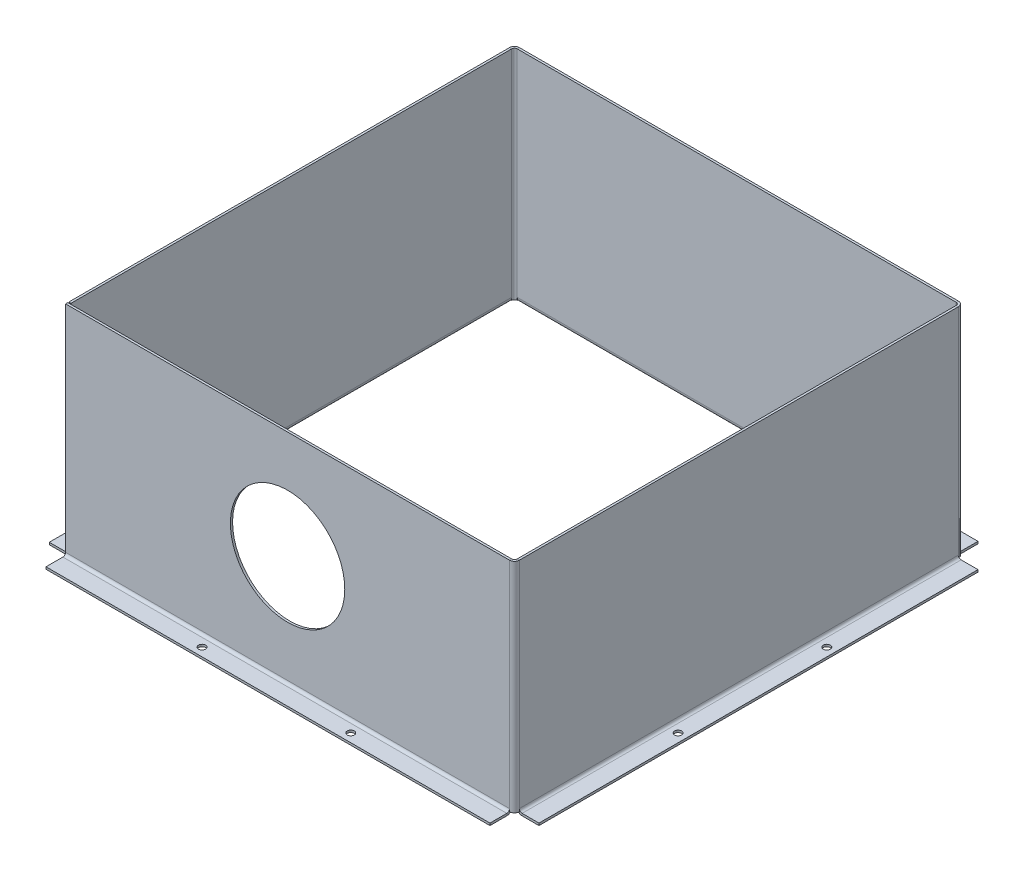
from build123d import *

# Parameters (mm, degrees)
SKETCH1_W                    = 410
SKETCH1_H                    = 200
BASE_FLANGE1_DEPTH           = 2
EDGE_FLANGE2_STRIP_W         = 13
EDGE_FLANGE2_STRIP_H         = 2
EDGE_FLANGE2_STRIP_CUT_DEPTH = 200
EDGE_FLANGE2_DEPTH           = 200
EDGE_FLANGE4_STRIP_W         = 13
EDGE_FLANGE4_STRIP_H         = 2
EDGE_FLANGE4_STRIP_CUT_DEPTH = 200
EDGE_FLANGE4_DEPTH           = 200
EDGE_FLANGE5_STRIP_W         = 13
EDGE_FLANGE5_STRIP_H         = 2
EDGE_FLANGE5_STRIP_CUT_DEPTH = 200
EDGE_FLANGE5_DEPTH           = 200
EDGE_FLANGE6_STRIP_W         = 13
EDGE_FLANGE6_STRIP_H         = 2
EDGE_FLANGE6_STRIP_CUT_DEPTH = 403
EDGE_FLANGE6_DEPTH           = 403
EDGE_FLANGE7_STRIP_W         = 13
EDGE_FLANGE7_STRIP_H         = 2
EDGE_FLANGE7_STRIP_CUT_DEPTH = 403
EDGE_FLANGE7_DEPTH           = 403
EDGE_FLANGE8_STRIP_W         = 13
EDGE_FLANGE8_STRIP_H         = 2
EDGE_FLANGE8_STRIP_CUT_DEPTH = 407.5
EDGE_FLANGE8_DEPTH           = 407.5
EDGE_FLANGE9_STRIP_W         = 13
EDGE_FLANGE9_STRIP_H         = 2
EDGE_FLANGE9_STRIP_CUT_DEPTH = 404.5
EDGE_FLANGE9_DEPTH           = 404.5
SKETCH29_R                   = 52.5
CUT_EXTRUDE1_DEPTH           = 10
SKETCH30_R                   = 3.25
CUT_EXTRUDE2_DEPTH           = 10


# Sheet-metal steps are written as plain solids
with BuildPart() as part:
    # Sketch1 → Base-Flange1 (new body)
    with BuildSketch(Plane.XY):
        with Locations((-14.494949495, 3.017676768)):
            Rectangle(SKETCH1_W, SKETCH1_H)
    extrude(amount=-BASE_FLANGE1_DEPTH)

    # Edge-Flange2 strip (across the edge) → Edge-Flange2 strip cut (cut)
    with BuildSketch(Plane(origin=(190.505050505, 103.017676768, -2), x_dir=(-1, 0, 0), z_dir=(0, -1, 0))):
        with Locations((-4, -1)):
            Rectangle(EDGE_FLANGE2_STRIP_W, EDGE_FLANGE2_STRIP_H)
    extrude(amount=EDGE_FLANGE2_STRIP_CUT_DEPTH, mode=Mode.SUBTRACT)

    # Edge-Flange2 section (across the edge) → Edge-Flange2 (add)
    with BuildSketch(Plane(origin=(190.505050505, 103.017676768, -2), x_dir=(-1, 0, 0), z_dir=(0, -1, 0))):
        with BuildLine():
            Line((-2, 2.5), (-2, 408))
            Line((-2, 408), (0, 408))
            Line((0, 408), (0, 2.5))
            ThreePointArc((0, 2.5), (0.732233047, 0.732233047), (2.5, 0))
            Line((2.5, 0), (2.5, -2))
            ThreePointArc((2.5, -2), (-0.681980515, -0.681980515), (-2, 2.5))
        make_face()
    extrude(amount=EDGE_FLANGE2_DEPTH)

    # Edge-Flange4 strip (across the edge) → Edge-Flange4 strip cut (cut)
    with BuildSketch(Plane(origin=(190.505050505, 103.017676768, -410), x_dir=(0, 0, 1), z_dir=(0, -1, 0))):
        with Locations((-4, -1)):
            Rectangle(EDGE_FLANGE4_STRIP_W, EDGE_FLANGE4_STRIP_H)
    extrude(amount=EDGE_FLANGE4_STRIP_CUT_DEPTH, mode=Mode.SUBTRACT)

    # Edge-Flange4 section (across the edge) → Edge-Flange4 (add)
    with BuildSketch(Plane(origin=(190.505050505, 103.017676768, -410), x_dir=(0, 0, 1), z_dir=(0, -1, 0))):
        with BuildLine():
            Line((-2, 2.5), (-2, 408))
            Line((-2, 408), (0, 408))
            Line((0, 408), (0, 2.5))
            ThreePointArc((0, 2.5), (0.732233047, 0.732233047), (2.5, 0))
            Line((2.5, 0), (2.5, -2))
            ThreePointArc((2.5, -2), (-0.681980515, -0.681980515), (-2, 2.5))
        make_face()
    extrude(amount=EDGE_FLANGE4_DEPTH)

    # Edge-Flange5 strip (across the edge) → Edge-Flange5 strip cut (cut)
    with BuildSketch(Plane(origin=(-217.494949495, 103.017676768, -410), x_dir=(1, 0, 0), z_dir=(0, -1, 0))):
        with Locations((-4, -1)):
            Rectangle(EDGE_FLANGE5_STRIP_W, EDGE_FLANGE5_STRIP_H)
    extrude(amount=EDGE_FLANGE5_STRIP_CUT_DEPTH, mode=Mode.SUBTRACT)

    # Edge-Flange5 section (across the edge) → Edge-Flange5 (add)
    with BuildSketch(Plane(origin=(-217.494949495, 103.017676768, -410), x_dir=(1, 0, 0), z_dir=(0, -1, 0))):
        with BuildLine():
            Line((-2, 2.5), (-2, 407))
            Line((-2, 407), (0, 407))
            Line((0, 407), (0, 2.5))
            ThreePointArc((0, 2.5), (0.732233047, 0.732233047), (2.5, 0))
            Line((2.5, 0), (2.5, -2))
            ThreePointArc((2.5, -2), (-0.681980515, -0.681980515), (-2, 2.5))
        make_face()
    extrude(amount=EDGE_FLANGE5_DEPTH)

    # Edge-Flange6 strip (across the edge) → Edge-Flange6 strip cut (cut)
    with BuildSketch(Plane(origin=(188.005050505, -96.982323232, -412), x_dir=(0, 1, 0), z_dir=(-1, 0, 0))):
        with Locations((-4, -1)):
            Rectangle(EDGE_FLANGE6_STRIP_W, EDGE_FLANGE6_STRIP_H)
    extrude(amount=EDGE_FLANGE6_STRIP_CUT_DEPTH, mode=Mode.SUBTRACT)

    # Edge-Flange6 section (across the edge) → Edge-Flange6 (add)
    with BuildSketch(Plane(origin=(188.005050505, -96.982323232, -412), x_dir=(0, 1, 0), z_dir=(-1, 0, 0))):
        with BuildLine():
            Line((-2, 2.5), (-2, 18))
            Line((-2, 18), (0, 18))
            Line((0, 18), (0, 2.5))
            ThreePointArc((0, 2.5), (0.732233047, 0.732233047), (2.5, 0))
            Line((2.5, 0), (2.5, -2))
            ThreePointArc((2.5, -2), (-0.681980515, -0.681980515), (-2, 2.5))
        make_face()
    extrude(amount=EDGE_FLANGE6_DEPTH)

    # Edge-Flange7 strip (across the edge) → Edge-Flange7 strip cut (cut)
    with BuildSketch(Plane(origin=(192.505050505, -96.982323232, -4.5), x_dir=(0, 1, 0), z_dir=(0, 0, -1))):
        with Locations((-4, -1)):
            Rectangle(EDGE_FLANGE7_STRIP_W, EDGE_FLANGE7_STRIP_H)
    extrude(amount=EDGE_FLANGE7_STRIP_CUT_DEPTH, mode=Mode.SUBTRACT)

    # Edge-Flange7 section (across the edge) → Edge-Flange7 (add)
    with BuildSketch(Plane(origin=(192.505050505, -96.982323232, -4.5), x_dir=(0, 1, 0), z_dir=(0, 0, -1))):
        with BuildLine():
            Line((-2, 2.5), (-2, 18))
            Line((-2, 18), (0, 18))
            Line((0, 18), (0, 2.5))
            ThreePointArc((0, 2.5), (0.732233047, 0.732233047), (2.5, 0))
            Line((2.5, 0), (2.5, -2))
            ThreePointArc((2.5, -2), (-0.681980515, -0.681980515), (-2, 2.5))
        make_face()
    extrude(amount=EDGE_FLANGE7_DEPTH)

    # Edge-Flange8 strip (across the edge) → Edge-Flange8 strip cut (cut)
    with BuildSketch(Plane(origin=(-219.494949495, -96.982323232, 0), x_dir=(0, 1, 0), z_dir=(1, 0, 0))):
        with Locations((-4, -1)):
            Rectangle(EDGE_FLANGE8_STRIP_W, EDGE_FLANGE8_STRIP_H)
    extrude(amount=EDGE_FLANGE8_STRIP_CUT_DEPTH, mode=Mode.SUBTRACT)

    # Edge-Flange8 section (across the edge) → Edge-Flange8 (add)
    with BuildSketch(Plane(origin=(-219.494949495, -96.982323232, 0), x_dir=(0, 1, 0), z_dir=(1, 0, 0))):
        with BuildLine():
            Line((-2, 2.5), (-2, 18))
            Line((-2, 18), (0, 18))
            Line((0, 18), (0, 2.5))
            ThreePointArc((0, 2.5), (0.732233047, 0.732233047), (2.5, 0))
            Line((2.5, 0), (2.5, -2))
            ThreePointArc((2.5, -2), (-0.681980515, -0.681980515), (-2, 2.5))
        make_face()
    extrude(amount=EDGE_FLANGE8_DEPTH)

    # Edge-Flange9 strip (across the edge) → Edge-Flange9 strip cut (cut)
    with BuildSketch(Plane(origin=(-219.494949495, -96.982323232, -407.5), x_dir=(0, 1, 0), z_dir=(0, 0, 1))):
        with Locations((-4, -1)):
            Rectangle(EDGE_FLANGE9_STRIP_W, EDGE_FLANGE9_STRIP_H)
    extrude(amount=EDGE_FLANGE9_STRIP_CUT_DEPTH, mode=Mode.SUBTRACT)

    # Edge-Flange9 section (across the edge) → Edge-Flange9 (add)
    with BuildSketch(Plane(origin=(-219.494949495, -96.982323232, -407.5), x_dir=(0, 1, 0), z_dir=(0, 0, 1))):
        with BuildLine():
            Line((-2, 2.5), (-2, 18))
            Line((-2, 18), (0, 18))
            Line((0, 18), (0, 2.5))
            ThreePointArc((0, 2.5), (0.732233047, 0.732233047), (2.5, 0))
            Line((2.5, 0), (2.5, -2))
            ThreePointArc((2.5, -2), (-0.681980515, -0.681980515), (-2, 2.5))
        make_face()
    extrude(amount=EDGE_FLANGE9_DEPTH)

    # Sketch29 → Cut-Extrude1 (cut)
    with BuildSketch(Plane.XY):
        with Locations((-15.744949495, 4.267676768)):
            Circle(SKETCH29_R)
    extrude(amount=-CUT_EXTRUDE1_DEPTH, mode=Mode.SUBTRACT)

    # Sketch30 → Cut-Extrude2 (cut)
    with BuildSketch(Plane(origin=(0, -96.982323232, 0), x_dir=(1, 0, 0), z_dir=(0, 1, 0))):
        with Locations(Location((-83.994949495, -10.25, 0), (0, 0, 270))):
            Circle(SKETCH30_R)
        with Locations(Location((52.505050505, -10.25, 0), (0, 0, 270))):
            Circle(SKETCH30_R)
        with Locations(Location((202.755050505, 140, 0), (0, 0, 270))):
            Circle(SKETCH30_R)
        with Locations(Location((202.755050505, 276.5, 0), (0, 0, 270))):
            Circle(SKETCH30_R)
        with Locations(Location((52.505050505, 422.25, 0), (0, 0, 270))):
            Circle(SKETCH30_R)
        with Locations(Location((-83.994949495, 422.25, 0), (0, 0, 270))):
            Circle(SKETCH30_R)
        with Locations(Location((-229.744949495, 272, 0), (0, 0, 270))):
            Circle(SKETCH30_R)
        with Locations(Location((-229.744949495, 135.5, 0), (0, 0, 270))):
            Circle(SKETCH30_R)
    extrude(amount=-CUT_EXTRUDE2_DEPTH, mode=Mode.SUBTRACT)


solid = part.part
